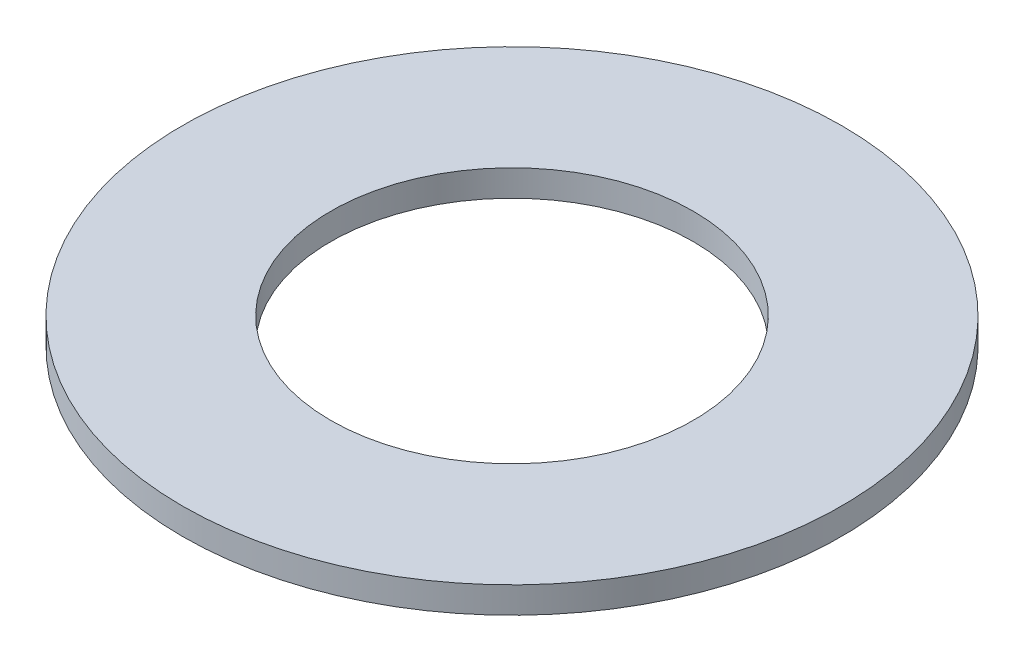
from build123d import *

# Parameters (mm, degrees)
SKETCH1_R           = 50
BOSS_EXTRUDE1_DEPTH = 4
SKETCH2_R           = 27.5
CUT_EXTRUDE1_DEPTH  = 71.823724839


with BuildPart() as part:
    # Sketch1 → Boss-Extrude1 (new body)
    with BuildSketch(Plane(origin=(0, 0, 0), x_dir=(1, 0, 0), z_dir=(0, 1, 0))):
        Circle(SKETCH1_R)
    extrude(amount=BOSS_EXTRUDE1_DEPTH)

    # Sketch2 → Cut-Extrude1 (cut, through all)
    with BuildSketch(Plane(origin=(0, 0, 0), x_dir=(1, 0, 0), z_dir=(0, 1, 0))):
        Circle(SKETCH2_R)
    extrude(amount=CUT_EXTRUDE1_DEPTH, mode=Mode.SUBTRACT)


solid = part.part
